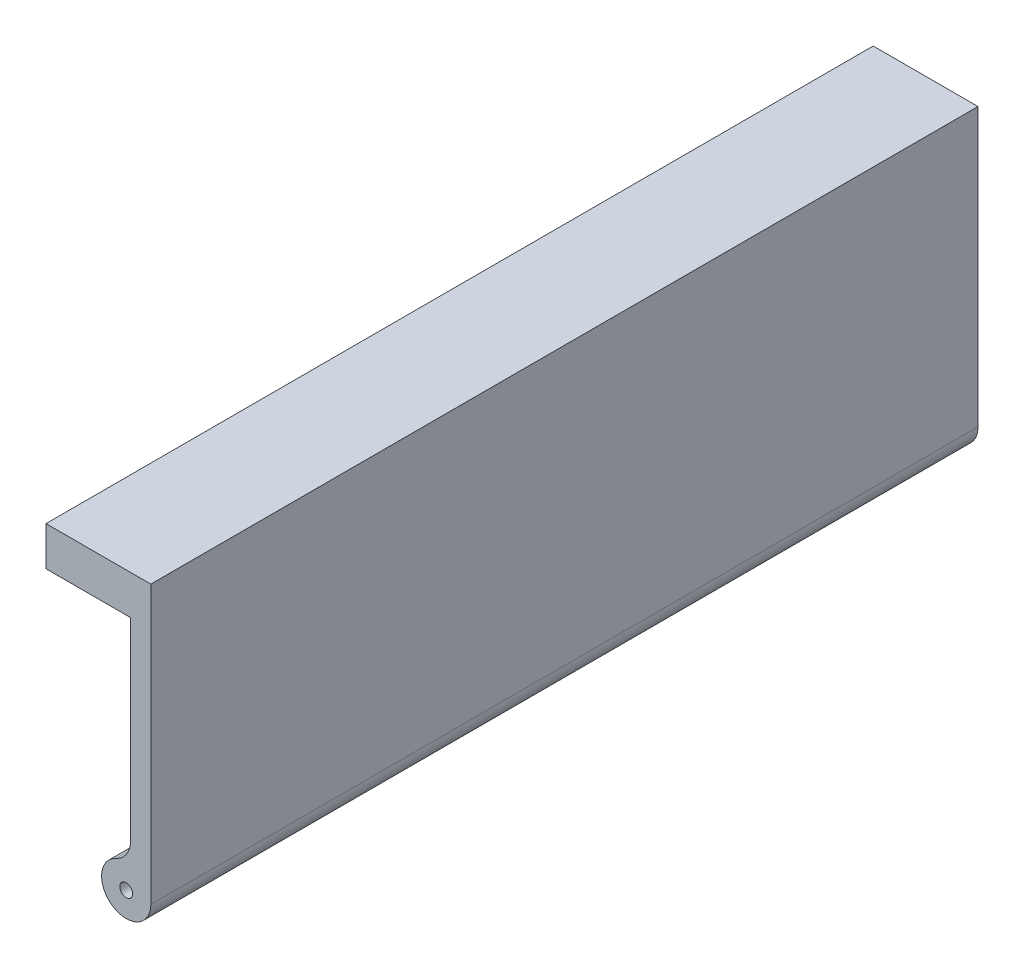
from build123d import *

# Parameters (mm, degrees)
SKETCH1_R           = 0.64
BOSS_EXTRUDE1_DEPTH = 82
SKETCH3_W           = 2
SKETCH3_H           = 82
BOSS_EXTRUDE4_DEPTH = 2.5
SKETCH6_W           = 82
SKETCH6_H           = 3.880734095
BOSS_EXTRUDE5_DEPTH = 8.39
SKETCH26_W          = 2
SKETCH26_H          = 6
CUT_EXTRUDE7_DEPTH  = 2


with BuildPart() as part:
    # Sketch1 → Boss-Extrude1 (new body)
    with BuildSketch(Plane.XY):
        with BuildLine():
            Line((2.44, 0), (2.44, 25))
            Line((2.44, 25), (0.44, 25))
            Line((0.44, 25), (0.44, 4.489988864))
            ThreePointArc((0.44, 4.489988864), (0.044314057, 3.140225052), (-1.017489879, 2.217727293))
            ThreePointArc((-1.017489879, 2.217727293), (-1.317369481, -2.05381052), (2.44, 0))
        make_face()
        Circle(SKETCH1_R, mode=Mode.SUBTRACT)
    extrude(amount=BOSS_EXTRUDE1_DEPTH)

    # Sketch3 → Boss-Extrude4 (add)
    with BuildSketch(Plane(origin=(0, 25, 0), x_dir=(1, 0, 0), z_dir=(0, 1, 0))):
        with Locations((1.44, -41)):
            Rectangle(SKETCH3_W, SKETCH3_H)
    extrude(amount=BOSS_EXTRUDE4_DEPTH)

    # Sketch6 → Boss-Extrude5 (add)
    with BuildSketch(Plane.ZY.offset(-0.44)):
        with Locations((41, 25.559632953)):
            Rectangle(SKETCH6_W, SKETCH6_H)
    extrude(amount=BOSS_EXTRUDE5_DEPTH)

    # Sketch26 → Cut-Extrude7 (cut)
    with BuildSketch(Plane.XZ.offset(-23.619265905)):
        with Locations((-6.95, 36.92283214)):
            Rectangle(SKETCH26_W, SKETCH26_H)
    extrude(amount=-CUT_EXTRUDE7_DEPTH, mode=Mode.SUBTRACT)


solid = part.part
